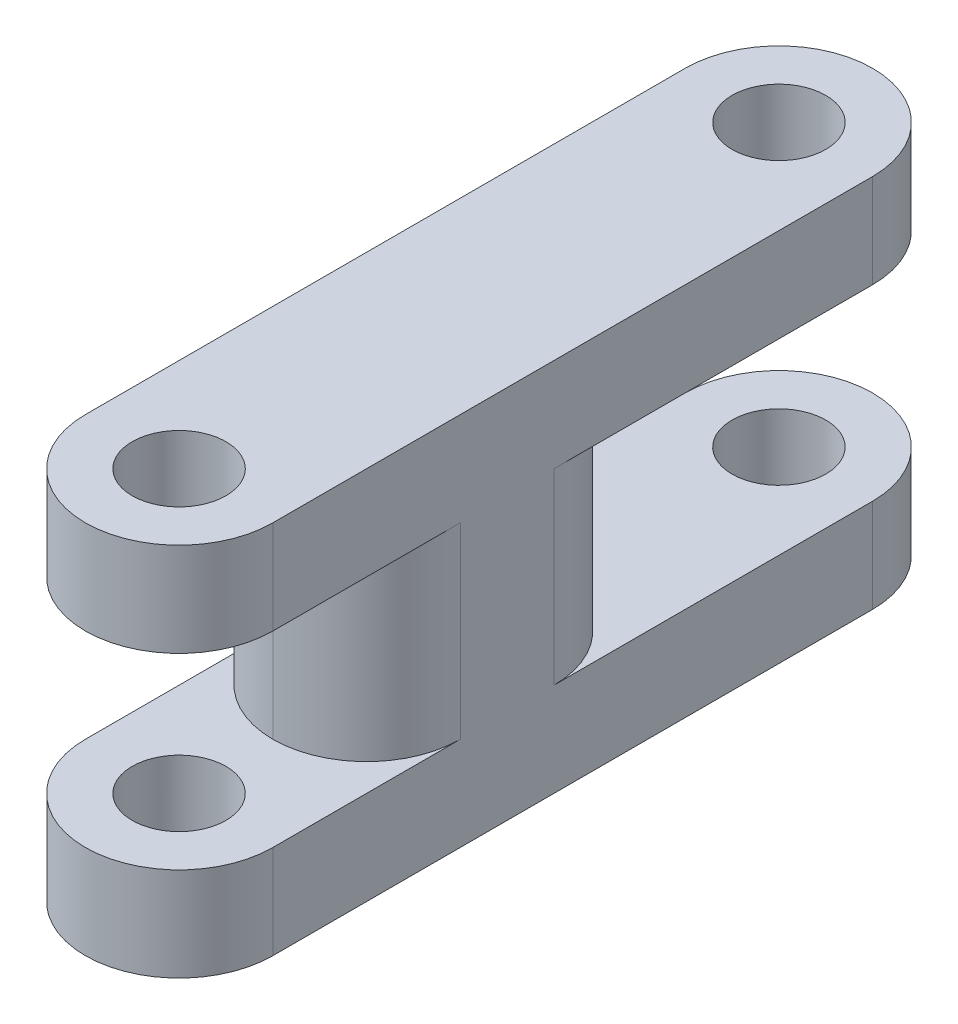
from build123d import *

# Parameters (mm, degrees)
SKETCH1_R           = 2.5
BOSS_EXTRUDE1_DEPTH = 20
SKETCH2_W           = 10
SKETCH2_H           = 10
CUT_EXTRUDE1_DEPTH  = 15
FILLET1_R           = 5
SKETCH3_W           = 25
SKETCH3_H           = 10
CUT_EXTRUDE3_DEPTH  = 10
FILLET3_R           = 5


with BuildPart() as part:
    # Sketch1 → Boss-Extrude1 (new body)
    with BuildSketch(Plane(origin=(0, 0, 0), x_dir=(1, 0, 0), z_dir=(0, 1, 0))):
        with BuildLine():
            Line((-5, 0), (-5, 32))
            ThreePointArc((-5, 32), (0, 37), (5, 32))
            Line((5, 32), (5, 0))
            ThreePointArc((5, 0), (0, -5), (-5, 0))
        make_face()
        with Locations(Location((0, 32, 0), (0, 0, 270))):
            Circle(SKETCH1_R, mode=Mode.SUBTRACT)
        with Locations(Location((0, 0, 0), (0, 0, 270))):
            Circle(SKETCH1_R, mode=Mode.SUBTRACT)
    extrude(amount=BOSS_EXTRUDE1_DEPTH)

    # Sketch2 → Cut-Extrude1 (cut)
    with BuildSketch(Plane(origin=(5, 0, 0), x_dir=(0, 0, -1), z_dir=(1, 0, 0))):
        with Locations((0, 10)):
            Rectangle(SKETCH2_W, SKETCH2_H)
    cut_extrude1 = extrude(amount=-CUT_EXTRUDE1_DEPTH, mode=Mode.SUBTRACT)

    # Mirror1: Cut-Extrude1 across plane
    add(cut_extrude1.mirror(Plane.XY.offset(-15)), mode=Mode.SUBTRACT)

    # Fillet1
    fillet1_edges = [part.edges().sort_by_distance(p)[0] for p in [
        (-5, 10, -25),
        (5, 10, -25),
        (-5, 10, -5),
        (5, 10, -5),
    ]]
    fillet(fillet1_edges, radius=FILLET1_R - 0.0001)  # a hair under: the kernel refuses the full size

    # Sketch3 → Cut-Extrude3 (cut)
    with BuildSketch(Plane(origin=(5, 0, 0), x_dir=(0, 0, -1), z_dir=(1, 0, 0))):
        with Locations((32.5, 10)):
            Rectangle(SKETCH3_W, SKETCH3_H)
    extrude(amount=-CUT_EXTRUDE3_DEPTH, mode=Mode.SUBTRACT)

    # Fillet3
    fillet3_edges = [part.edges().sort_by_distance(p)[0] for p in [
        (-5, 10, -20.0001),
        (5, 10, -20.0001),
    ]]
    fillet(fillet3_edges, radius=FILLET3_R - 0.0001)  # a hair under: the kernel refuses the full size


solid = part.part
